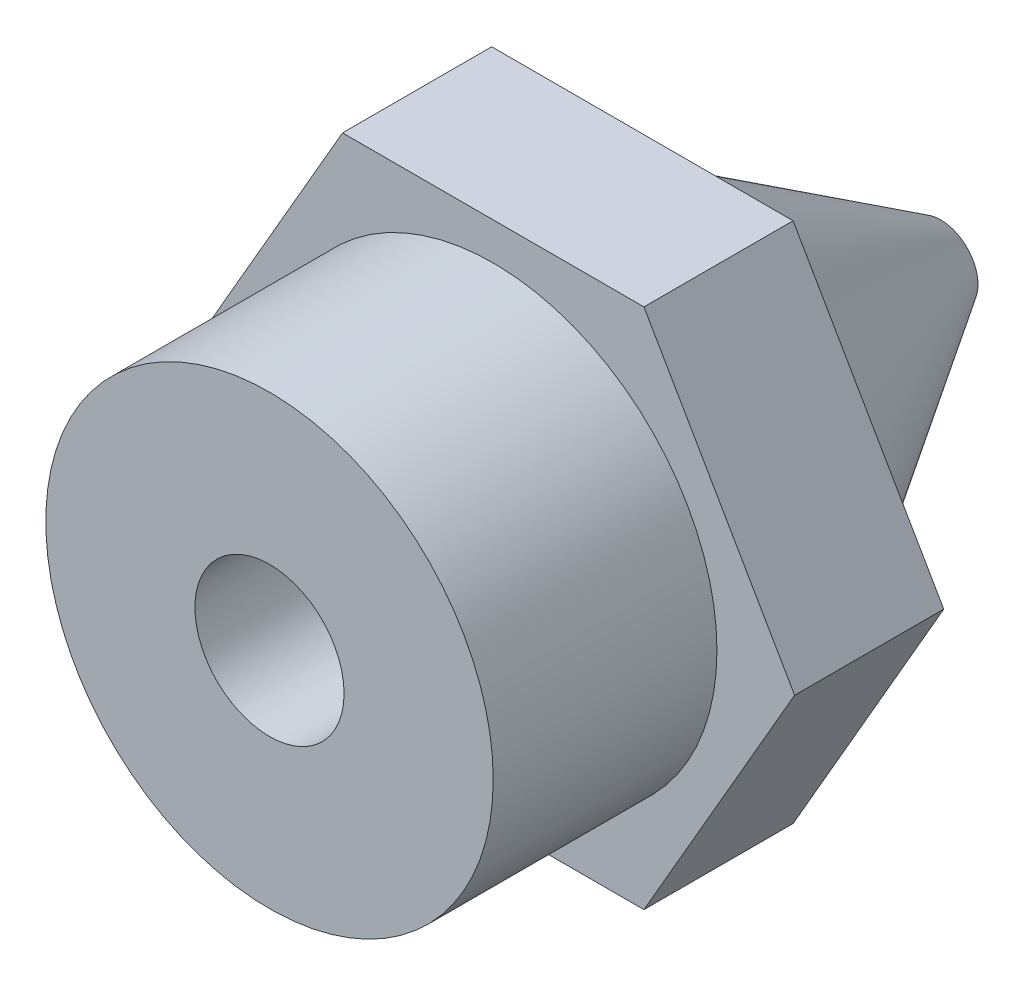
from build123d import *

# Parameters (mm, degrees)
BOSS_EXTRU_1_DEPTH      = 9
ESQUISSE2_W             = 15.557161579
ESQUISSE2_H             = 11.468773674
ESQUISSE2_R             = 3
ENL_V_MAT_EXTRU_1_DEPTH = 3
ENL_V_START             = -4
ESQUISSE3_W             = 15.323034965
ESQUISSE3_H             = 11.861185192
ESQUISSE3_R             = 3
ENL_V_MAT_EXTRU_3_DEPTH = 4
CHANFREIN2_SIZE         = 4
CHANFREIN2_SIZE_2       = 2.499477408


with BuildPart() as part:
    # Esquisse1 → Boss.-Extru.1 (new body)
    with BuildSketch(Plane.XY):
        Polygon((4.041451884, 0), (2.020725942, 3.5), (-2.020725942, 3.5), (-4.041451884, 0), (-2.020725942, -3.5), (2.020725942, -3.5), align=None)
    extrude(amount=BOSS_EXTRU_1_DEPTH)

    # Esquisse2 → Enlèv. mat.-Extru.1 (cut)
    with BuildSketch(Plane.XY.offset(9)):
        with Locations((-0.212602531, -0.232116366)):
            Rectangle(ESQUISSE2_W, ESQUISSE2_H)
        Circle(ESQUISSE2_R, mode=Mode.SUBTRACT)
    extrude(amount=-ENL_V_MAT_EXTRU_1_DEPTH, mode=Mode.SUBTRACT)

    # Esquisse3 → Enlèv. mat.-Extru.3 (cut)
    with BuildSketch(Plane(origin=(0, 0, 0), x_dir=(-1, 0, 0), z_dir=(0, 0, -1)).offset(ENL_V_START)):
        with Locations((0.20407301, -0.146192801)):
            Rectangle(ESQUISSE3_W, ESQUISSE3_H)
        with Locations(Location((0, 0, 0), (0, 0, 180))):
            Circle(ESQUISSE3_R, mode=Mode.SUBTRACT)
    extrude(amount=ENL_V_MAT_EXTRU_3_DEPTH, mode=Mode.SUBTRACT)

    # Chanfrein2
    # the kernel refuses this chamfer: 4, 2.499477408 mm, written as the material it takes off along each edge
    with BuildSketch(Plane(origin=(0, 0, 0), x_dir=(1, 0, 0), z_dir=(0, 1, 0))) as chanfrein2_piece_1_section:
        Polygon((3, -CHANFREIN2_SIZE), (3 - CHANFREIN2_SIZE_2, 0), (3, 0), align=None)
    chanfrein2_piece_1 = revolve(axis=Axis((0, 0, 0), (0, 0, -1)), mode=Mode.PRIVATE)
    chanfrein2_piece_1 = split(chanfrein2_piece_1, bisect_by=Plane(origin=(-1.744026904, 0, 4), z_dir=(0, 0, -1)), keep=Keep.TOP, mode=Mode.PRIVATE)
    add(chanfrein2_piece_1, mode=Mode.SUBTRACT)

    # Esquisse4 → Enlèvement de matière-Révolution1 (revolve, cut)
    with BuildSketch(Plane(origin=(0, 0, 0), x_dir=(1, 0, 0), z_dir=(0, 1, 0))):
        Polygon((0, 1.4), (1, -6.6), (1, -9), (0, -9), align=None)
    revolve(axis=Axis((0, 0, 9), (0, 0, -1)), mode=Mode.SUBTRACT)


solid = part.part
